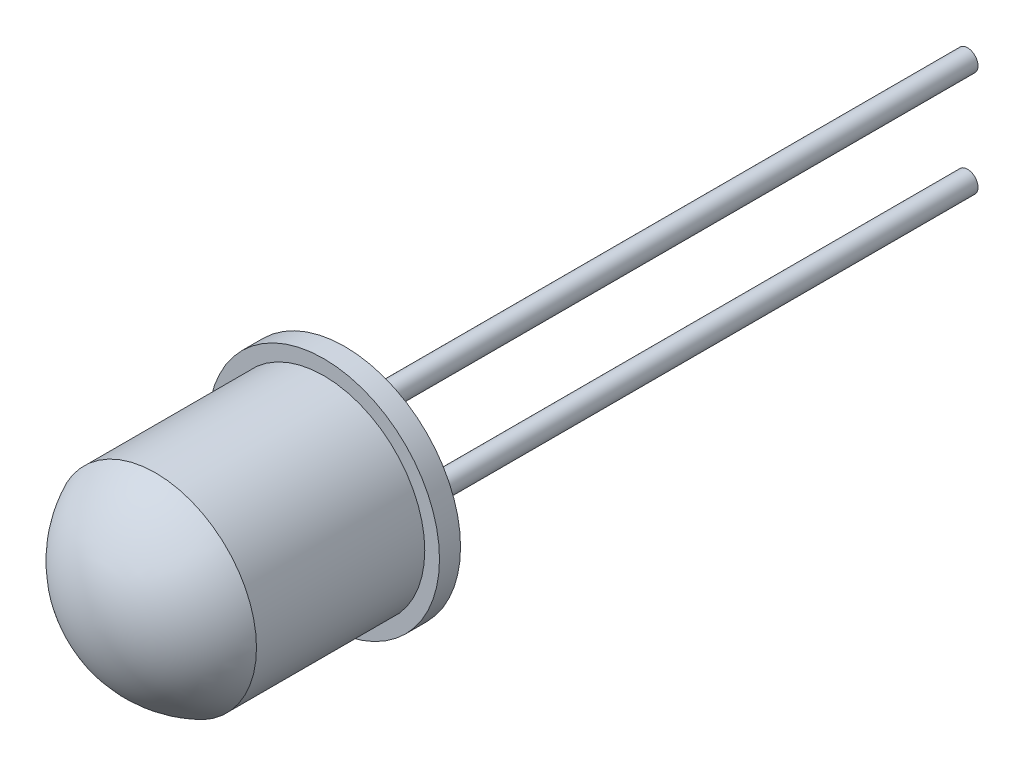
from build123d import *

# Parameters (mm, degrees)
SKETCH2_R           = 2.75
BOSS_EXTRUDE2_DEPTH = 0.5
SKETCH4_R           = 2.4
BOSS_EXTRUDE3_DEPTH = 4
SKETCH5_R           = 2.4
CUT_EXTRUDE1_DEPTH  = 0.2
SKETCH6_R           = 0.25
BOSS_EXTRUDE4_DEPTH = 15


# Read off the part's stored shape, not the designer's step: Dome1
with BuildPart() as part:
    # Sketch2 → Boss-Extrude2 (new body)
    with BuildSketch(Plane.XY):
        Circle(SKETCH2_R)
    extrude(amount=BOSS_EXTRUDE2_DEPTH)

    # Sketch4 → Boss-Extrude3 (add)
    with BuildSketch(Plane.XY.offset(0.5)):
        Circle(SKETCH4_R)
    extrude(amount=BOSS_EXTRUDE3_DEPTH)

    # Dome1 outline → Dome1 (revolve)
    with BuildSketch(Plane.XZ):
        with BuildLine():
            Line((0, 4.5), (2.400000001, 4.499999998))
            ThreePointArc((2.400000001, 4.499999998), (1.415097171, 5.594155471), (0, 6))
            Line((0, 6), (0, 4.5))
        make_face()
    revolve(axis=Axis((0, 0, 0), (0, 0, 1)))

    # Sketch5 → Cut-Extrude1 (cut)
    with BuildSketch(Plane(origin=(0, 0, 0), x_dir=(-1, 0, 0), z_dir=(0, 0, -1))):
        with Locations(Location((0, 0, 0), (0, 0, 180))):
            Circle(SKETCH5_R)
    extrude(amount=-CUT_EXTRUDE1_DEPTH, mode=Mode.SUBTRACT)

    # Sketch6 → Boss-Extrude4 (add)
    with BuildSketch(Plane(origin=(0, 0, 0.2), x_dir=(-1, 0, 0), z_dir=(0, 0, -1))):
        with Locations((0, 1.25)):
            Circle(SKETCH6_R)
        with Locations((1.25, 0)):
            Circle(SKETCH6_R)
        with Locations((0, -1.25)):
            Circle(SKETCH6_R)
    extrude(amount=BOSS_EXTRUDE4_DEPTH)


solid = part.part
